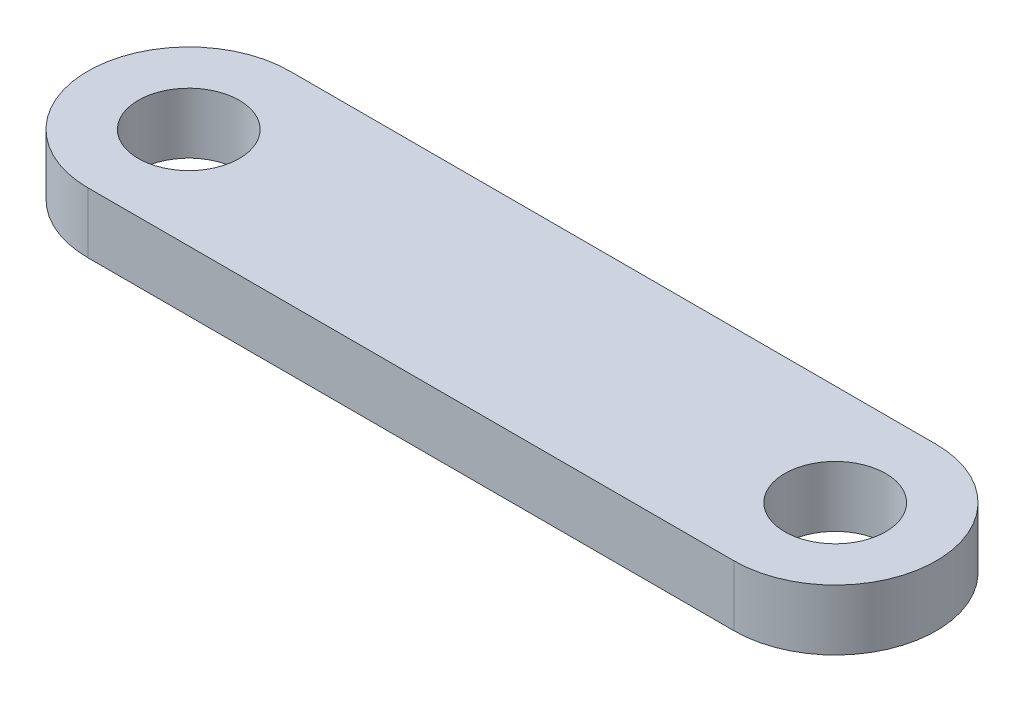
from build123d import *

# Parameters (mm, degrees)
SKETCH1_R           = 3.175
BOSS_EXTRUDE1_DEPTH = 3.81


with BuildPart() as part:
    # Sketch1 → Boss-Extrude1 (new body)
    with BuildSketch(Plane(origin=(0, 0, 0), x_dir=(1, 0, 0), z_dir=(0, 1, 0))):
        with BuildLine():
            Line((-20.32, 6.35), (20.32, 6.35))
            ThreePointArc((20.32, 6.35), (26.67, 0), (20.32, -6.35))
            Line((20.32, -6.35), (-20.32, -6.35))
            ThreePointArc((-20.32, -6.35), (-26.67, 0), (-20.32, 6.35))
        make_face()
        with Locations((-20.32, 0)):
            Circle(SKETCH1_R, mode=Mode.SUBTRACT)
        with Locations((20.32, 0)):
            Circle(SKETCH1_R, mode=Mode.SUBTRACT)
    extrude(amount=BOSS_EXTRUDE1_DEPTH)


solid = part.part
